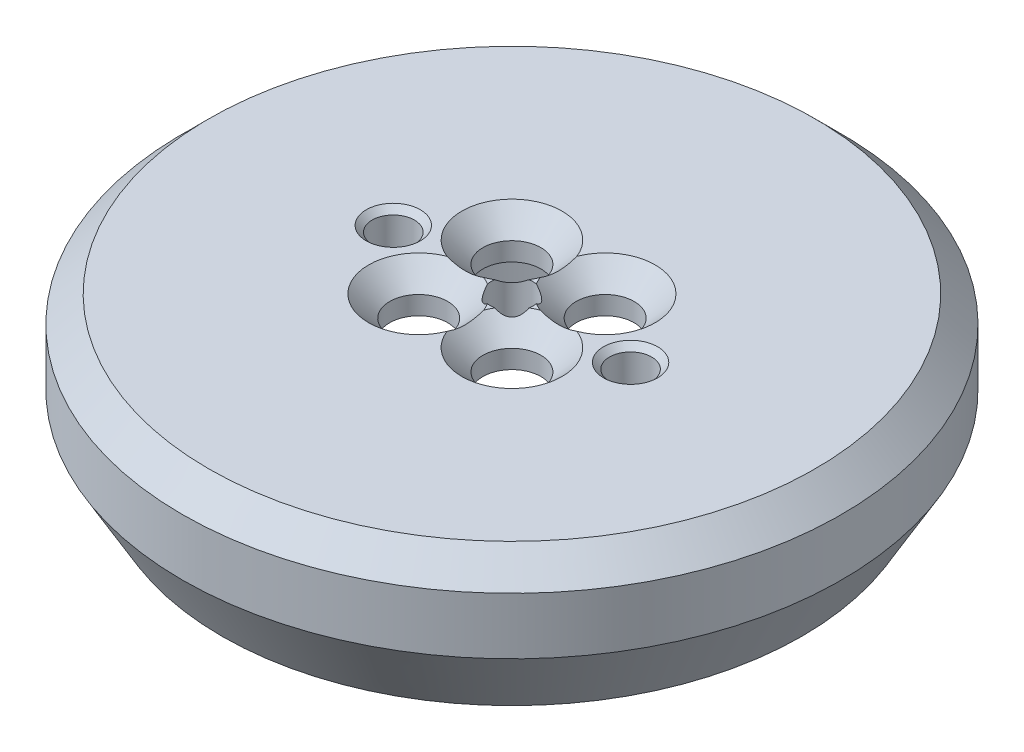
from build123d import *

# Parameters (mm, degrees)
SKETCH1_R                                       = 12.5
BOSS_EXTRUDE1_DEPTH                             = 1.5
CUT_EXTRUDE1_DEPTH                              = 18.741194999
CUT_EXTRUDE1_DEPTH_BACK                         = 18.741194999
SKETCH2_R                                       = 0.8
CSK_FOR_M2_FLAT_HEAD_MACHINE_SCREW1_D           = 2.2
CSK_FOR_M2_FLAT_HEAD_MACHINE_SCREW1_DEPTH       = 5
CSK_FOR_M2_FLAT_HEAD_MACHINE_SCREW1_CSINK_D     = 3.8
CSK_FOR_M2_FLAT_HEAD_MACHINE_SCREW1_CSINK_ANGLE = 90
CSK_FOR_M2_FLAT_HEAD_MACHINE_SCREW1_TIP         = 0.660946681
BOSS_EXTRUDE2_START                             = 3
SKETCH7_R                                       = 12.5
SKETCH7_R_2                                     = 7.2
BOSS_EXTRUDE2_DEPTH                             = 3
FILLET1_R                                       = 1
CHAMFER1_SIZE                                   = 1
CHAMFER2_SIZE                                   = 1
CHAMFER3_SIZE                                   = 1.5
CHAMFER3_SIZE2                                  = 2.598076211
M2X0_4_TAPPED_HOLE1_D                           = 1.6
M2X0_4_TAPPED_HOLE1_DEPTH                       = 5.2
M2X0_4_TAPPED_HOLE1_CSINK_D                     = 2.05
M2X0_4_TAPPED_HOLE1_CSINK_ANGLE                 = 90
M2X0_4_TAPPED_HOLE1_TIP                         = 0.480688495


with BuildPart() as part:
    # Sketch1 → Boss-Extrude1 (new body)
    with BuildSketch(Plane(origin=(0, 0, 0), x_dir=(1, 0, 0), z_dir=(0, 1, 0))):
        Circle(SKETCH1_R)
    extrude(amount=BOSS_EXTRUDE1_DEPTH)

    # Sketch2 → Cut-Extrude1 (cut, two sides: drawn at the far end of the back side and taken through both)
    with BuildSketch(Plane(origin=(0, 1.5, 0), x_dir=(1, 0, 0), z_dir=(0, 1, 0)).offset(-CUT_EXTRUDE1_DEPTH_BACK)):
        Circle(SKETCH2_R)
    extrude(amount=CUT_EXTRUDE1_DEPTH + CUT_EXTRUDE1_DEPTH_BACK, mode=Mode.SUBTRACT)

    # CSK for M2 Flat Head Machine Screw1
    with Locations(Plane(origin=(0, 1.5, 0), x_dir=(1, 0, 0), z_dir=(0, 1, 0))):
        with Locations((-1.767766953, 1.767766953), (1.767766953, 1.767766953), (1.767766953, -1.767766953), (-1.767766953, -1.767766953)):
            CounterSinkHole(CSK_FOR_M2_FLAT_HEAD_MACHINE_SCREW1_D / 2, CSK_FOR_M2_FLAT_HEAD_MACHINE_SCREW1_CSINK_D / 2, depth=CSK_FOR_M2_FLAT_HEAD_MACHINE_SCREW1_DEPTH, counter_sink_angle=CSK_FOR_M2_FLAT_HEAD_MACHINE_SCREW1_CSINK_ANGLE)
            with Locations((0, 0, -(CSK_FOR_M2_FLAT_HEAD_MACHINE_SCREW1_DEPTH + CSK_FOR_M2_FLAT_HEAD_MACHINE_SCREW1_TIP / 2))):  # 118° drill point
                Cone(0, CSK_FOR_M2_FLAT_HEAD_MACHINE_SCREW1_D / 2, CSK_FOR_M2_FLAT_HEAD_MACHINE_SCREW1_TIP, mode=Mode.SUBTRACT)

    # Sketch6 → Revolve1 (revolve)
    with BuildSketch(Plane.XY):
        Polygon((-12.5, 0), (-12.5, -1.25), (-7.2, -1.25), (-5, 0), align=None)
    revolve(axis=Axis((0, 0, 0), (0, -1, 0)))

    # Sketch7 → Boss-Extrude2 (add)
    with BuildSketch(Plane.XZ.offset(1.25).offset(BOSS_EXTRUDE2_START)):
        Circle(SKETCH7_R)
        Circle(SKETCH7_R_2, mode=Mode.SUBTRACT)
    extrude(amount=-BOSS_EXTRUDE2_DEPTH)

    # Fillet1
    fillet1_edges = [part.edges().sort_by_distance(p)[0] for p in [
        (5, 0, 0),
        (0, -1.25, 7.2),
    ]]
    fillet(fillet1_edges, radius=FILLET1_R)

    # Chamfer1
    chamfer1_edges = [part.edges().sort_by_distance(p)[0] for p in [
        (-12.5, 1.5, 0),
    ]]
    chamfer(chamfer1_edges, length=CHAMFER1_SIZE)

    # Chamfer2
    chamfer2_edges = [part.edges().sort_by_distance(p)[0] for p in [
        (-7.2, -4.25, 0),
    ]]
    chamfer(chamfer2_edges, length=CHAMFER2_SIZE)

    # Chamfer3
    chamfer3_edges = [part.edges().sort_by_distance(p)[0] for p in [
        (-12.5, -4.25, 0),
    ]]
    chamfer3_side = [part.faces().sort_by_distance(p)[0] for p in [
        (-8.553553391, -4.25, 0),
    ]]
    chamfer(chamfer3_edges, length=CHAMFER3_SIZE, length2=CHAMFER3_SIZE2, reference=chamfer3_side[0])

    # M2x0.4 Tapped Hole1
    with Locations(Plane(origin=(0, 1.5, 0), x_dir=(1, 0, 0), z_dir=(0, 1, 0))):
        with Locations((-4.5, 0), (4.5, 0)):
            CounterSinkHole(M2X0_4_TAPPED_HOLE1_D / 2, M2X0_4_TAPPED_HOLE1_CSINK_D / 2, depth=M2X0_4_TAPPED_HOLE1_DEPTH, counter_sink_angle=M2X0_4_TAPPED_HOLE1_CSINK_ANGLE)
            with Locations((0, 0, -(M2X0_4_TAPPED_HOLE1_DEPTH + M2X0_4_TAPPED_HOLE1_TIP / 2))):  # 118° drill point
                Cone(0, M2X0_4_TAPPED_HOLE1_D / 2, M2X0_4_TAPPED_HOLE1_TIP, mode=Mode.SUBTRACT)


solid = part.part
